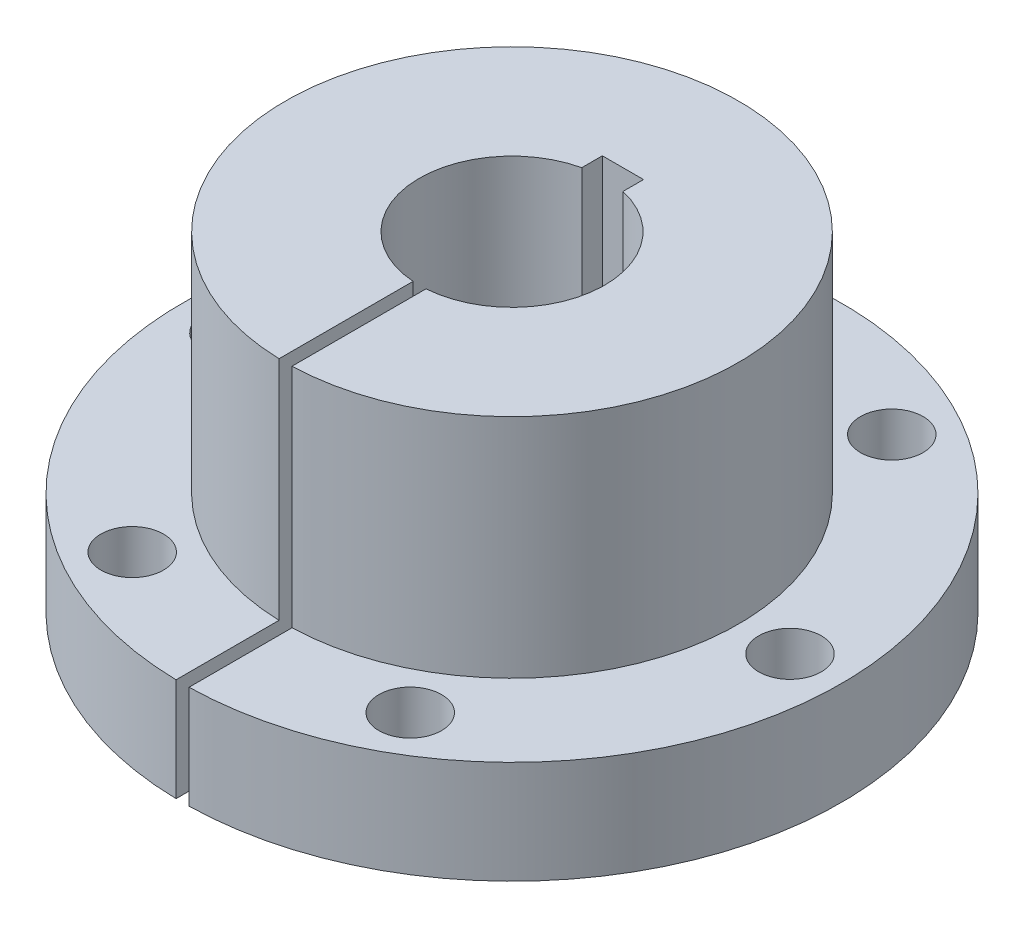
from build123d import *

# Parameters (mm, degrees)
SKETCH1_R           = 25.4
BOSS_EXTRUDE1_DEPTH = 7.9375
SKETCH2_R           = 17.4625
BOSS_EXTRUDE2_DEPTH = 17.4625
CUT_EXTRUDE1_DEPTH  = 44.994090512
SKETCH4_R           = 2.413
CUT_EXTRUDE2_DEPTH  = 40.940692361
CIRPATTERN1_COUNT   = 6


with BuildPart() as part:
    # Sketch1 → Boss-Extrude1 (new body)
    with BuildSketch(Plane(origin=(0, 0, 0), x_dir=(1, 0, 0), z_dir=(0, 1, 0))):
        Circle(SKETCH1_R)
    extrude(amount=BOSS_EXTRUDE1_DEPTH)

    # Sketch2 → Boss-Extrude2 (add)
    with BuildSketch(Plane(origin=(0, 7.9375, 0), x_dir=(1, 0, 0), z_dir=(0, 1, 0))):
        Circle(SKETCH2_R)
    extrude(amount=BOSS_EXTRUDE2_DEPTH)

    # Sketch3 → Cut-Extrude1 (cut, through all)
    with BuildSketch(Plane(origin=(0, 25.4, 0), x_dir=(1, 0, 0), z_dir=(0, 1, 0))):
        with BuildLine():
            Line((-1.5875, 8.552627982), (1.5875, 8.552627982))
            Line((1.5875, 8.552627982), (1.5875, 6.965127982))
            ThreePointArc((1.5875, 6.965127982), (7.122570567, -0.549684077), (0.5, -7.126230705))
            Line((0.5, -7.126230705), (0.5, -25.4))
            Line((0.5, -25.4), (-0.5, -25.4))
            Line((-0.5, -25.4), (-0.5, -7.126230705))
            ThreePointArc((-0.5, -7.126230705), (-7.122570567, -0.549684077), (-1.5875, 6.965127982))
            Line((-1.5875, 6.965127982), (-1.5875, 8.552627982))
        make_face()
    extrude(amount=-CUT_EXTRUDE1_DEPTH, mode=Mode.SUBTRACT)

    # Sketch4 → Cut-Extrude2 (cut, through all)
    with BuildSketch(Plane(origin=(0, 7.9375, 0), x_dir=(1, 0, 0), z_dir=(0, 1, 0))):
        with Locations((-21.43125, 0)):
            Circle(SKETCH4_R)
    cut_extrude2 = extrude(amount=-CUT_EXTRUDE2_DEPTH, mode=Mode.SUBTRACT)

    # CirPattern1: Cut-Extrude2 ×6 about axis
    cirpattern1_axis = Axis((0, 7.9375, 0), (0, 1, 0))
    for i in range(1, CIRPATTERN1_COUNT):
        add(cut_extrude2.rotate(cirpattern1_axis, i * 360 / CIRPATTERN1_COUNT), mode=Mode.SUBTRACT)


solid = part.part
